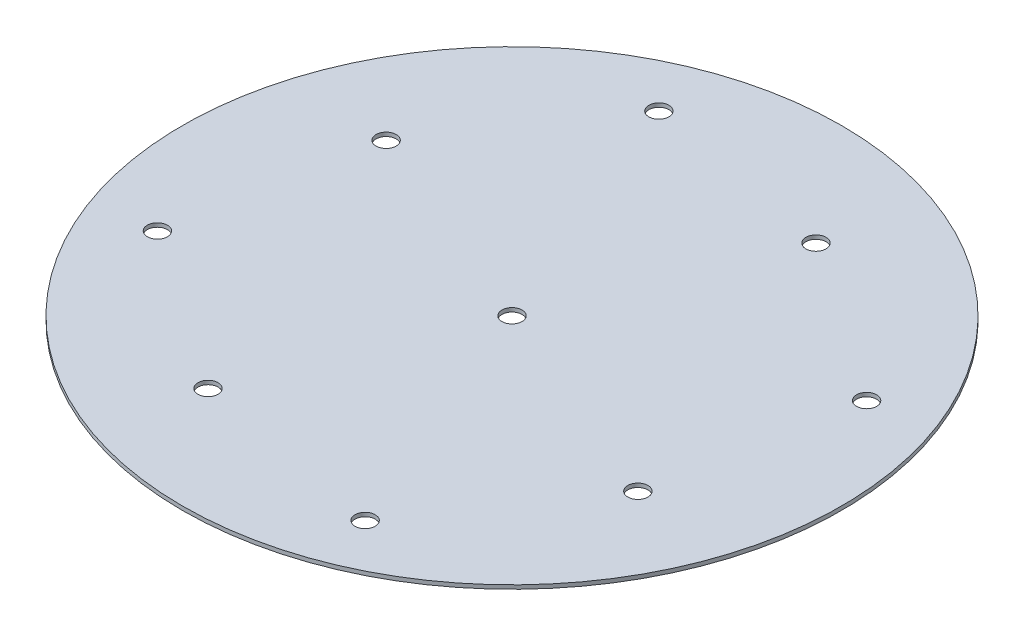
from build123d import *

# Parameters (mm, degrees)
SKETCH2_W                  = 84.99983
SKETCH2_H                  = 1
F_6_0_204_DIAMETER_HOLE1_D = 5.1816
CIRPATTERN3_COUNT          = 4
F_6_0_204_DIAMETER_HOLE2_D = 5.1816


with BuildPart() as part:
    # Sketch2 → Revolve1 (revolve)
    with BuildSketch(Plane(origin=(0, 0, 0), x_dir=(0, 0, -1), z_dir=(1, 0, 0))):
        with Locations((-42.499915, 0.5)):
            Rectangle(SKETCH2_W, SKETCH2_H)
    revolve(axis=Axis((0, -0.75, 0), (0, 1, 0)))

    # #6 (0.204) Diameter Hole1 (through all)
    with Locations(Plane(origin=(0, 1, 0), x_dir=(1, 0, 0), z_dir=(0, 1, 0))):
        with Locations((-26.787840266, 64.671567276), (264.743675233, 73.787758551), (-55.432771951, 22.961005942)):
            f_6_0_204_diameter_hole1 = Hole(F_6_0_204_DIAMETER_HOLE1_D / 2)

    # CirPattern3: #6 (0.204) Diameter Hole1 ×4 about axis
    cirpattern3_axis = Axis((0, -0.75, 0), (0, 1, 0))
    for i in range(1, CIRPATTERN3_COUNT):
        add(f_6_0_204_diameter_hole1.rotate(cirpattern3_axis, i * 360 / CIRPATTERN3_COUNT), mode=Mode.SUBTRACT)

    # #6 (0.204) Diameter Hole2 (through all)
    with Locations(Plane(origin=(0, 1, 0), x_dir=(1, 0, 0), z_dir=(0, 1, 0))):
        with Locations((0, 0)):
            Hole(F_6_0_204_DIAMETER_HOLE2_D / 2)


solid = part.part
